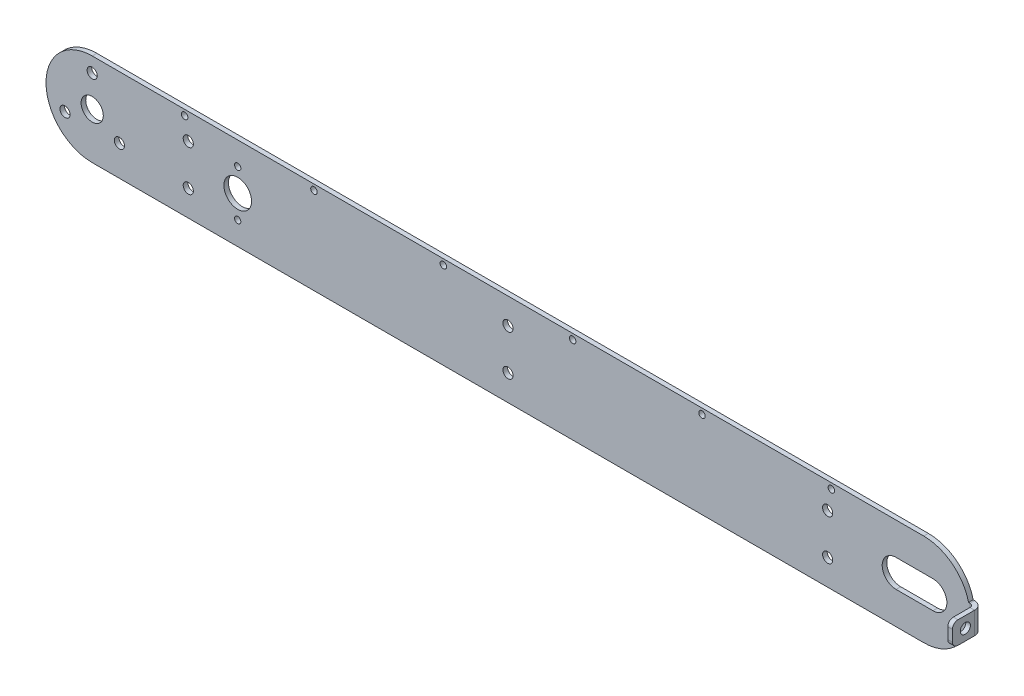
from build123d import *
from build123d.topology import SkipClean

# Parameters (mm, degrees)
AUFSATZ_LINEAR_AUSTRAGEN1_DEPTH        = 2.5
SKIZZE7_W                              = 2.5
SKIZZE7_H                              = 6
AUFSATZ_LINEAR_AUSTRAGEN2_DEPTH        = 14
VERRUNDUNG2_R                          = 3
F_5_5_5_5_DURCHMESSER_BOHRUNG1_D       = 5.5
KREISMUSTER1_COUNT                     = 3
DURCHGANGSLOCH_F_R_M51_D               = 5.5
DURCHGANGSLOCH_F_R_M51_DEPTH           = 9.5
DURCHGANGSLOCH_F_R_M51_TIP             = 1.652366702
F_3_5_3_5_DURCHMESSER_BOHRUNG1_D       = 3.5
DURCHGANGSLOCH_F_R_M52_D               = 5.5
SPIEGELN2_AT_THE_SECOND_PLANE_COPY_1_D = 5.5
SCHNITT_LINEAR_AUSTRAGEN1_REACH        = 482.355
SKIZZE19_R                             = 7.5
VOLUMENK_RPER_START                    = -6
VOLUMENK_RPER_UMWANDELN1_DEPTH         = 12
VOLUMENK_RPER_UMWANDELN1_2_DEPTH       = 12


# Read off the part's stored shape, not the designer's step: Volumenkörper umwandeln1
with BuildPart() as part:
    # Skizze1 → Aufsatz-Linear austragen1 (new body)
    with BuildSketch(Plane.XY):
        with BuildLine():
            Line((-6, 0), (-25, 0))
            ThreePointArc((-25, 0), (-17.67766953, 17.67766953), (0, 25))
            Line((0, 25), (450, 25))
            ThreePointArc((450, 25), (465.411035007, 19.685019685), (474.269322199, 6))
            Line((474.269322199, 6), (479.5, 6))
            Line((479.5, 6), (479.5, 0))
            Line((479.5, 0), (477, 0))
            Line((477, 0), (475, 0))
            Line((475, 0), (462.5, 0))
            ThreePointArc((462.5, 0), (460.303300859, 5.303300859), (455, 7.5))
            Line((455, 7.5), (450, 7.5))
            Line((450, 7.5), (435, 7.5))
            ThreePointArc((435, 7.5), (429.696699141, 5.303300859), (427.5, 0))
            Line((427.5, 0), (6, 0))
            ThreePointArc((6, 0), (0, 6), (-6, 0))
        make_face()
    extrude(amount=-AUFSATZ_LINEAR_AUSTRAGEN1_DEPTH)

    # Skizze7 → Aufsatz-Linear austragen2 (add)
    with BuildSketch(Plane.XY):
        with Locations((478.25, 3)):
            Rectangle(SKIZZE7_W, SKIZZE7_H)
    extrude(amount=AUFSATZ_LINEAR_AUSTRAGEN2_DEPTH)

    # Verrundung2
    verrundung2_edges = [part.edges().sort_by_distance(p)[0] for p in [
        (478.25, 6, 14),
    ]]
    fillet(verrundung2_edges, radius=VERRUNDUNG2_R)

    # Spiegeln1: part across plane


with BuildPart() as part_1:
    with SkipClean():  # the faces are left unmerged after this step: merging them gives an invalid solid
        add(part.part)
        add(part.part.mirror(Plane(origin=(6, 0, -2.5), x_dir=(0, 0, 1), z_dir=(0, -1, 0))))

    # Ø5.5 (5.5) Durchmesser Bohrung1 (through all)
    with Locations(Plane.XY):
        with Locations((0, 17)):
            f_5_5_5_5_durchmesser_bohrung1 = Hole(F_5_5_5_5_DURCHMESSER_BOHRUNG1_D / 2)

    # Kreismuster1: Ø5.5 (5.5) Durchmesser Bohrung1 ×3 about axis
    with SkipClean():  # the faces are left unmerged after this step: merging them gives an invalid solid
        kreismuster1_axis = Axis((0, 0, 0), (0, 0, 1))
        for i in range(1, KREISMUSTER1_COUNT):
            add(f_5_5_5_5_durchmesser_bohrung1.rotate(kreismuster1_axis, i * 360 / KREISMUSTER1_COUNT), mode=Mode.SUBTRACT)

    # Durchgangsloch für M51
    with Locations(Plane(origin=(479.5, 0, 0), x_dir=(0, 0, -1), z_dir=(1, 0, 0))):
        with Locations((-7, 0)):
            Hole(DURCHGANGSLOCH_F_R_M51_D / 2, depth=DURCHGANGSLOCH_F_R_M51_DEPTH)
            with Locations((0, 0, -(DURCHGANGSLOCH_F_R_M51_DEPTH + DURCHGANGSLOCH_F_R_M51_TIP / 2))):  # 118° drill point
                Cone(0, DURCHGANGSLOCH_F_R_M51_D / 2, DURCHGANGSLOCH_F_R_M51_TIP, mode=Mode.SUBTRACT)

    # Ø3.5 (3.5) Durchmesser Bohrung1 (through all)
    with Locations(Plane.XY):
        with Locations((400, 22), (330, 22), (260, 22), (190, 22), (120, 22), (50, 22)):
            Hole(F_3_5_3_5_DURCHMESSER_BOHRUNG1_D / 2)

    # Durchgangsloch für M52 (through all)
    with Locations(Plane.XY):
        with Locations((52, 11), (225, 11)):
            durchgangsloch_f_r_m52 = Hole(DURCHGANGSLOCH_F_R_M52_D / 2)

    # Spiegeln2: Durchgangsloch für M52 across plane
    with SkipClean():  # the faces are left unmerged after this step: merging them gives an invalid solid
        add(durchgangsloch_f_r_m52.mirror(Plane(origin=(225, 0, 0), x_dir=(0, 0, 1), z_dir=(1, 0, 0))), mode=Mode.SUBTRACT)

    # Spiegeln2 at the second plane: Durchgangsloch für M52 across plane
    with SkipClean():  # the faces are left unmerged after this step: merging them gives an invalid solid
        add(durchgangsloch_f_r_m52.mirror(Plane.ZX), mode=Mode.SUBTRACT)

    # Spiegeln2 at the second plane copy 1 (through all)
    with Locations(Plane(origin=(450, 0, 0), x_dir=(-1, 0, 0), z_dir=(0, 0, 1))):
        with Locations((52, 11), (225, 11)):
            Hole(SPIEGELN2_AT_THE_SECOND_PLANE_COPY_1_D / 2)

    # Skizze19 → Schnitt-Linear austragen1 (cut, up to next)
    with BuildSketch(Plane.XY, mode=Mode.PRIVATE) as schnitt_linear_austragen1_sk1:
        with Locations((78.75, 0)):
            Circle(SKIZZE19_R)
    schnitt_linear_austragen1_tool1 = extrude(schnitt_linear_austragen1_sk1.sketch, amount=-SCHNITT_LINEAR_AUSTRAGEN1_REACH, mode=Mode.PRIVATE) & part_1.part
    add(schnitt_linear_austragen1_tool1.solids().sort_by_distance((78.75, 0, 0))[0], mode=Mode.SUBTRACT)

    # Skizze22 → Durchgangsloch für M31 (revolve, cut)
    with SkipClean():  # the faces are left unmerged after this step: merging them gives an invalid solid
        with BuildSketch(Plane(origin=(78.75, 12.5, 0), x_dir=(0, -1, 0), z_dir=(1, 0, 0))):
            Polygon((0, 0), (0, 3.771463052), (1.7, 2.75), (1.7, 0), align=None)
        durchgangsloch_f_r_m31 = revolve(axis=Axis((78.75, 12.5, 6.35), (0, 0, -1)), mode=Mode.SUBTRACT)

    # Spiegeln3: Durchgangsloch für M31 across plane
    with SkipClean():  # the faces are left unmerged after this step: merging them gives an invalid solid
        add(durchgangsloch_f_r_m31.mirror(Plane.ZX), mode=Mode.SUBTRACT)

    # Volumenkörper umwandeln1 outline → Volumenkörper umwandeln1 (cut)
    with SkipClean():  # the faces are left unmerged after this step: merging them gives an invalid solid
        with BuildSketch(Plane(origin=(0, 0, 0), x_dir=(1, 0, 0), z_dir=(0, 1, 0)).offset(VOLUMENK_RPER_START)):
            with BuildLine():
                Line((479.5, 2.5), (475, 2.5))
                ThreePointArc((475, 2.5), (478.181980515, 1.181980515), (479.5, -2))
                Line((479.5, -2), (479.5, 2.5))
            make_face()
        extrude(amount=VOLUMENK_RPER_UMWANDELN1_DEPTH, mode=Mode.SUBTRACT)

    # Volumenk_rper umwandeln1 2 outline → Volumenk_rper umwandeln1 2 (add)
    with BuildSketch(Plane(origin=(0, 0, 0), x_dir=(1, 0, 0), z_dir=(0, 1, 0)).offset(VOLUMENK_RPER_START)):
        with BuildLine():
            Line((477, 0), (475, 0))
            ThreePointArc((475, 0), (476.414213562, -0.585786438), (477, -2))
            Line((477, -2), (477, 0))
        make_face()
    extrude(amount=VOLUMENK_RPER_UMWANDELN1_2_DEPTH)


solid = part_1.part
